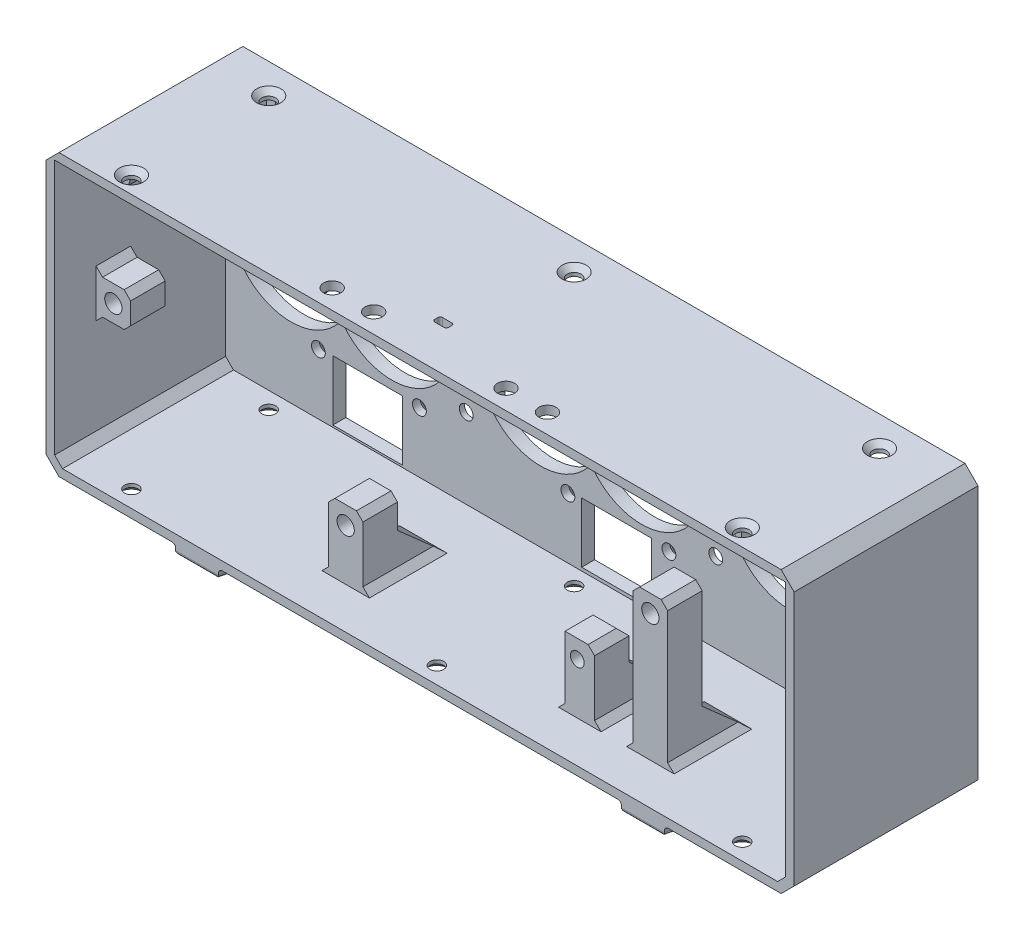
from build123d import *
from OCP.BRepFilletAPI import BRepFilletAPI_MakeChamfer

# Parameters (mm, degrees)
SKETCH1_W              = 173.3
SKETCH1_H              = 65
BOSS_EXTRUDE1_DEPTH    = 60
SHELL1_START           = -68.127794562
SHELL1_OUTLINE_W       = 61
SHELL1_OUTLINE_H       = 55
SHELL1_DEPTH           = 169.3
SKETCH3_W              = 219.37101133
SKETCH3_H              = 94.638771208
CUT_EXTRUDE3_DEPTH     = 17.4
BOSS_EXTRUDE2_DEPTH    = 30
SKETCH6_R              = 2
CUT_EXTRUDE5_DEPTH     = 9
SKETCH9_W              = 8
SKETCH9_H              = 8
BOSS_EXTRUDE3_DEPTH    = 16
SKETCH10_W             = 8
SKETCH10_H             = 8
BOSS_EXTRUDE4_DEPTH    = 33.5
SKETCH11_R             = 2
SKETCH11_R_2           = 1.6
CUT_EXTRUDE6_DEPTH     = 9
RIB5_REACH             = 138.256
SKETCH14_WALL_W        = 287.846240822
SKETCH14_WALL_H        = 8
RIB7_REACH             = 152.639
SKETCH16_WALL_W        = 316.612464196
SKETCH16_WALL_H        = 8
RIB12_REACH            = 138.256
SKETCH49_WALL_W        = 288.114138462
SKETCH49_WALL_H        = 8
SKETCH21_W             = 8
SKETCH21_H             = 8
BOSS_EXTRUDE5_DEPTH    = 8
SKETCH22_R             = 2
CUT_EXTRUDE10_DEPTH    = 9
SKETCH46_W             = 3
SKETCH46_H             = 6.581793069
CUT_EXTRUDE26_DEPTH    = 6.85
CUT_EXTRUDE7_START     = -18
CUT_EXTRUDE7_OUTLINE_W = 1.15
CUT_EXTRUDE7_OUTLINE_H = 16
CUT_EXTRUDE7_DEPTH     = 18
CHAMFER5_SIZE          = 2.8
CHAMFER5_SIZE2         = 1.616580754
SKETCH19_R             = 1.6
CUT_EXTRUDE8_DEPTH     = 3
SKETCH20_W             = 10.4
SKETCH20_H             = 32.4
CUT_EXTRUDE9_DEPTH     = 1.8
SKETCH24_R             = 1.6
CUT_EXTRUDE12_DEPTH    = 1.2
SKETCH25_R             = 2
CUT_EXTRUDE13_DEPTH    = 2
CUT_EXTRUDE14_DEPTH    = 2
SKETCH39_R             = 1.6
CUT_EXTRUDE21_DEPTH    = 2
CUT_EXTRUDE20_START    = -2
SKETCH38_R             = 1.6
CUT_EXTRUDE20_DEPTH    = 2
SKETCH40_W             = 16.181333655
SKETCH40_H             = 13.908508066
SKETCH40_W_2           = 16.181333654
SKETCH40_H_2           = 13.908508065
SKETCH40_W_3           = 24.137032917
SKETCH40_H_3           = 10.833560852
CUT_EXTRUDE22_DEPTH    = 3
SKETCH42_W             = 10
SKETCH42_H             = 40
BOSS_EXTRUDE6_DEPTH    = 10
CUT_EXTRUDE23_REACH    = 163.935
CHAMFER3_SIZE          = 3
CHAMFER1_SIZE          = 1.5
CHAMFER2_SIZE          = 1.2
FILLET2_R              = 0.8
CHAMFER4_SIZE          = 1.828427


# Read off the part's stored shape, not the designer's step: Shell1, Cut-Extrude7
with BuildPart() as part:
    # Sketch1 → Boss-Extrude1 (new body)
    with BuildSketch(Plane.XY):
        with Locations((16.522205438, 29.735649547)):
            Rectangle(SKETCH1_W, SKETCH1_H)
    extrude(amount=BOSS_EXTRUDE1_DEPTH)

    # Shell1 outline → Shell1 (cut)
    with BuildSketch(Plane.YZ.offset(SHELL1_START)):
        with Locations((29.735649547, 30.5)):
            Rectangle(SHELL1_OUTLINE_W, SHELL1_OUTLINE_H)
    extrude(amount=SHELL1_DEPTH, mode=Mode.SUBTRACT)

    # Sketch3 → Cut-Extrude3 (cut)
    with BuildSketch(Plane.XY.offset(60)):
        with Locations((3.172205438, 21.820567217)):
            Rectangle(SKETCH3_W, SKETCH3_H)
    extrude(amount=-CUT_EXTRUDE3_DEPTH, mode=Mode.SUBTRACT)

    # Sketch5 → Boss-Extrude2 (add)
    with BuildSketch(Plane.XY.offset(3)):
        with BuildLine():
            Line((-68.127794562, 60.235649547), (-60.127794562, 60.235649547))
            Line((-60.127794562, 60.235649547), (-60.127794562, 56.235649547))
            ThreePointArc((-60.127794562, 56.235649547), (-61.299367437, 53.407222422), (-64.127794562, 52.235649547))
            Line((-64.127794562, 52.235649547), (-68.127794562, 52.235649547))
            Line((-68.127794562, 52.235649547), (-68.127794562, 60.235649547))
        make_face()
        with BuildLine():
            Line((101.172205438, 60.235649547), (93.172205438, 60.235649547))
            Line((93.172205438, 60.235649547), (93.172205438, 56.235649547))
            ThreePointArc((93.172205438, 56.235649547), (94.343778313, 53.407222422), (97.172205438, 52.235649547))
            Line((97.172205438, 52.235649547), (101.172205438, 52.235649547))
            Line((101.172205438, 52.235649547), (101.172205438, 60.235649547))
        make_face()
        with BuildLine():
            Line((-31.227794562, 60.235649547), (-15.727794562, 60.235649547))
            Line((-15.727794562, 60.235649547), (-15.727794562, 56.235649547))
            ThreePointArc((-15.727794562, 56.235649547), (-16.899367437, 53.407222422), (-19.727794562, 52.235649547))
            Line((-19.727794562, 52.235649547), (-27.227794562, 52.235649547))
            ThreePointArc((-27.227794562, 52.235649547), (-30.056221687, 53.407222422), (-31.227794562, 56.235649547))
            Line((-31.227794562, 56.235649547), (-31.227794562, 60.235649547))
        make_face()
        with BuildLine():
            Line((56.272205438, 60.235649547), (64.272205438, 60.235649547))
            Line((64.272205438, 60.235649547), (64.272205438, 56.235649547))
            ThreePointArc((64.272205438, 56.235649547), (60.272205438, 52.235649547), (56.272205438, 56.235649547))
            Line((56.272205438, 56.235649547), (56.272205438, 60.235649547))
        make_face()
    extrude(amount=BOSS_EXTRUDE2_DEPTH)

    # Sketch6 → Cut-Extrude5 (cut)
    with BuildSketch(Plane.XY.offset(33)):
        with Locations((-64.127794562, 56.235649547)):
            Circle(SKETCH6_R)
        with Locations((-27.227794562, 56.235649547)):
            Circle(SKETCH6_R)
        with Locations((-19.727794562, 56.235649547)):
            Circle(SKETCH6_R)
        with Locations((60.272205438, 56.235649547)):
            Circle(SKETCH6_R)
        with Locations((97.172205438, 56.235649547)):
            Circle(SKETCH6_R)
    extrude(amount=-CUT_EXTRUDE5_DEPTH, mode=Mode.SUBTRACT)

    # Sketch9 → Boss-Extrude3 (add)
    with BuildSketch(Plane(origin=(0, -0.764350453, 0), x_dir=(1, 0, 0), z_dir=(0, 1, 0))):
        with Locations((43.352205438, -29)):
            Rectangle(SKETCH9_W, SKETCH9_H)
        with Locations((-10.307794562, -29)):
            Rectangle(SKETCH9_W, SKETCH9_H)
    extrude(amount=BOSS_EXTRUDE3_DEPTH)

    # Sketch10 → Boss-Extrude4 (add)
    with BuildSketch(Plane(origin=(0, -0.764350453, 0.764350453), x_dir=(1, 0, 0), z_dir=(0, -1, 0))):
        with Locations((60.272205438, 28.235649547)):
            Rectangle(SKETCH10_W, SKETCH10_H)
    extrude(amount=-BOSS_EXTRUDE4_DEPTH)

    # Sketch11 → Cut-Extrude6 (cut)
    with BuildSketch(Plane.XY.offset(33)):
        with Locations((-10.307794562, 11.055649547)):
            Circle(SKETCH11_R)
        with Locations((43.352205438, 11.055649547)):
            Circle(SKETCH11_R_2)
        with Locations((60.272205438, 28.685649547)):
            Circle(SKETCH11_R)
    extrude(amount=-CUT_EXTRUDE6_DEPTH, mode=Mode.SUBTRACT)

    # Sketch14 wall → Rib5 (add, up to next)
    with BuildSketch(Plane(origin=(-10.307794562, 3.645649547, 20), x_dir=(0, -0.661472797491, -0.749969158153), z_dir=(0, -0.749969158153, 0.661472797491)), mode=Mode.PRIVATE) as rib5_sk1:
        Rectangle(SKETCH14_WALL_W, SKETCH14_WALL_H)
    rib5_tool1 = extrude(rib5_sk1.sketch, amount=RIB5_REACH, mode=Mode.PRIVATE) - part.part
    add(rib5_tool1.solids().sort_by_distance((-10.307794562, 3.645649547, 20))[0])

    # Sketch16 wall → Rib7 (add, up to next)
    with BuildSketch(Plane(origin=(60.272205438, 3.645649547, 20), x_dir=(0, -0.661472797491, -0.749969158153), z_dir=(0, -0.749969158153, 0.661472797491)), mode=Mode.PRIVATE) as rib7_sk1:
        Rectangle(SKETCH16_WALL_W, SKETCH16_WALL_H)
    rib7_tool1 = extrude(rib7_sk1.sketch, amount=RIB7_REACH, mode=Mode.PRIVATE) - part.part
    add(rib7_tool1.solids().sort_by_distance((60.272205438, 3.645649547, 20))[0])

    # Sketch49 wall → Rib12 (add, up to next)
    with BuildSketch(Plane(origin=(43.352205438, 3.845649547, 20), x_dir=(0, -0.677852492662, -0.735197931303), z_dir=(0, -0.735197931303, 0.677852492662)), mode=Mode.PRIVATE) as rib12_sk1:
        Rectangle(SKETCH49_WALL_W, SKETCH49_WALL_H)
    rib12_tool1 = extrude(rib12_sk1.sketch, amount=RIB12_REACH, mode=Mode.PRIVATE) - part.part
    add(rib12_tool1.solids().sort_by_distance((43.352205438, 3.845649547, 20))[0])

    # Sketch21 → Boss-Extrude5 (add)
    with BuildSketch(Plane(origin=(-68.127794562, 0, 0), x_dir=(0, 0, -1), z_dir=(1, 0, 0))):
        with Locations((-29, 28.685649547)):
            Rectangle(SKETCH21_W, SKETCH21_H)
    extrude(amount=BOSS_EXTRUDE5_DEPTH)

    # Sketch22 → Cut-Extrude10 (cut)
    with BuildSketch(Plane.XY.offset(33)):
        with Locations((-64.127794562, 28.685649547)):
            Circle(SKETCH22_R)
    extrude(amount=-CUT_EXTRUDE10_DEPTH, mode=Mode.SUBTRACT)

    # Sketch46 → Cut-Extrude26 (cut)
    with BuildSketch(Plane.ZY.offset(-39.352205438)):
        with Locations((29, 11.055649547)):
            Rectangle(SKETCH46_W, SKETCH46_H)
    extrude(amount=-CUT_EXTRUDE26_DEPTH, mode=Mode.SUBTRACT)

    # Cut-Extrude7 outline → Cut-Extrude7 (cut)
    with BuildSketch(Plane.XY.offset(33).offset(CUT_EXTRUDE7_START)):
        with Locations((39.927205438, 7.235649547)):
            Rectangle(CUT_EXTRUDE7_OUTLINE_W, CUT_EXTRUDE7_OUTLINE_H)
    extrude(amount=CUT_EXTRUDE7_DEPTH, mode=Mode.SUBTRACT)

    # Chamfer5: one chamfer whose edges measure the first distance from different faces: ONE call of the kernel's chamfer builder (chamfer() names one face for all edges)
    chamfer5_edges_1 = [part.edges().sort_by_distance(p)[0] for p in [
        (46.202205438, 14.346546081, 29),
    ]]
    chamfer5_side_1 = [part.faces().sort_by_distance(p)[0] for p in [
        (43.352205438, 14.346546081, 29),
    ]]
    chamfer5_edges_2 = [part.edges().sort_by_distance(p)[0] for p in [
        (46.202205438, 7.764753012, 29),
    ]]
    chamfer5_side_2 = [part.faces().sort_by_distance(p)[0] for p in [
        (43.352205438, 7.764753012, 29),
    ]]
    chamfer5 = BRepFilletAPI_MakeChamfer(part.part.solid().wrapped)
    for e in chamfer5_edges_1:
        chamfer5.Add(CHAMFER5_SIZE, CHAMFER5_SIZE2, e.wrapped, chamfer5_side_1[0].wrapped)  # the first distance lies on this face
    for e in chamfer5_edges_2:
        chamfer5.Add(CHAMFER5_SIZE, CHAMFER5_SIZE2, e.wrapped, chamfer5_side_2[0].wrapped)  # the first distance lies on this face
    add(Compound.cast(chamfer5.Shape()), mode=Mode.REPLACE)

    # Sketch19 → Cut-Extrude8 (cut)
    with BuildSketch(Plane(origin=(0, 0, 0), x_dir=(-1, 0, 0), z_dir=(0, 0, -1))):
        with Locations((1.527794562, 46.235649547)):
            Circle(SKETCH19_R)
        with Locations((-11.172205438, 13.235649547)):
            Circle(SKETCH19_R)
        with Locations((-34.572205438, 13.235649547)):
            Circle(SKETCH19_R)
        with Locations((-21.872205438, 46.235649547)):
            Circle(SKETCH19_R)
        with Locations((23.227794562, 13.235649547)):
            Circle(SKETCH19_R)
        with Locations((46.627794562, 13.235649547)):
            Circle(SKETCH19_R)
        with Locations((35.927794562, 46.235649547)):
            Circle(SKETCH19_R)
        with Locations((59.327794562, 46.235649547)):
            Circle(SKETCH19_R)
        with Locations((-92.372205438, 13.235649547)):
            Circle(SKETCH19_R)
        with Locations((-79.672205438, 46.235649547)):
            Circle(SKETCH19_R)
        with Locations((-56.272205438, 46.235649547)):
            Circle(SKETCH19_R)
        with Locations((-68.972205438, 13.235649547)):
            Circle(SKETCH19_R)
        with BuildLine():
            Line((6.377794562, 38.464910684), (6.377794562, 21.00638841))
            ThreePointArc((6.377794562, 21.00638841), (-4.822205438, 15.535649547), (-16.022205438, 21.00638841))
            Line((-16.022205438, 21.00638841), (-16.022205438, 38.464910684))
            ThreePointArc((-16.022205438, 38.464910684), (-4.822205438, 43.935649547), (6.377794562, 38.464910684))
        make_face()
        with BuildLine():
            Line((-74.822205438, 21.00638841), (-74.822205438, 38.464910684))
            ThreePointArc((-74.822205438, 38.464910684), (-86.022205438, 43.935649547), (-97.222205438, 38.464910684))
            Line((-97.222205438, 38.464910684), (-97.222205438, 21.00638841))
            ThreePointArc((-97.222205438, 21.00638841), (-86.022205438, 15.535649547), (-74.822205438, 21.00638841))
        make_face()
        with BuildLine():
            Line((40.777794562, 38.464910684), (40.777794562, 21.00638841))
            ThreePointArc((40.777794562, 21.00638841), (29.577794562, 15.535649547), (18.377794562, 21.00638841))
            Line((18.377794562, 21.00638841), (18.377794562, 38.464910684))
            ThreePointArc((18.377794562, 38.464910684), (29.577794562, 43.935649547), (40.777794562, 38.464910684))
        make_face()
        with BuildLine():
            Line((64.177794562, 38.464910684), (64.177794562, 21.00638841))
            ThreePointArc((64.177794562, 21.00638841), (52.977794562, 15.535649547), (41.777794562, 21.00638841))
            Line((41.777794562, 21.00638841), (41.777794562, 38.464910684))
            ThreePointArc((41.777794562, 38.464910684), (52.977794562, 43.935649547), (64.177794562, 38.464910684))
        make_face()
        with BuildLine():
            Line((-51.422205438, 21.00638841), (-51.422205438, 38.464910684))
            ThreePointArc((-51.422205438, 38.464910684), (-62.622205438, 43.935649547), (-73.822205438, 38.464910684))
            Line((-73.822205438, 38.464910684), (-73.822205438, 21.00638841))
            ThreePointArc((-73.822205438, 21.00638841), (-62.622205438, 15.535649547), (-51.422205438, 21.00638841))
        make_face()
        with BuildLine():
            Line((-17.022205438, 21.00638841), (-17.022205438, 38.464910684))
            ThreePointArc((-17.022205438, 38.464910684), (-28.222205438, 43.935649547), (-39.422205438, 38.464910684))
            Line((-39.422205438, 38.464910684), (-39.422205438, 21.00638841))
            ThreePointArc((-39.422205438, 21.00638841), (-28.222205438, 15.535649547), (-17.022205438, 21.00638841))
        make_face()
    extrude(amount=-CUT_EXTRUDE8_DEPTH, mode=Mode.SUBTRACT)

    # Sketch20 → Cut-Extrude9 (cut)
    with BuildSketch(Plane(origin=(0, 0, 0), x_dir=(-1, 0, 0), z_dir=(0, 0, -1))):
        with Locations((12.377794562, 29.735649547)):
            Rectangle(SKETCH20_W, SKETCH20_H)
        with Locations((-45.422205438, 29.735649547)):
            Rectangle(SKETCH20_W, SKETCH20_H)
    extrude(amount=-CUT_EXTRUDE9_DEPTH, mode=Mode.SUBTRACT)

    # Sketch24 → Cut-Extrude12 (cut)
    with BuildSketch(Plane(origin=(0, 0, 1.8), x_dir=(-1, 0, 0), z_dir=(0, 0, -1))):
        with Locations((12.377794562, 41.735649547)):
            Circle(SKETCH24_R)
        with Locations((12.377794562, 17.735649547)):
            Circle(SKETCH24_R)
        with Locations(Location((-45.422205438, 41.735649547, 0), (0, 0, 180))):
            Circle(SKETCH24_R)
        with Locations(Location((-45.422205438, 17.735649547, 0), (0, 0, 180))):
            Circle(SKETCH24_R)
        with BuildLine():
            Line((8.877794562, 38.735649547), (15.877794562, 38.735649547))
            ThreePointArc((15.877794562, 38.735649547), (16.584901343, 38.442756328), (16.877794562, 37.735649547))
            Line((16.877794562, 37.735649547), (16.877794562, 21.735649547))
            ThreePointArc((16.877794562, 21.735649547), (16.584901343, 21.028542766), (15.877794562, 20.735649547))
            Line((15.877794562, 20.735649547), (8.877794562, 20.735649547))
            ThreePointArc((8.877794562, 20.735649547), (8.170687781, 21.028542766), (7.877794562, 21.735649547))
            Line((7.877794562, 21.735649547), (7.877794562, 37.735649547))
            ThreePointArc((7.877794562, 37.735649547), (8.170687781, 38.442756328), (8.877794562, 38.735649547))
        make_face()
        with BuildLine():
            Line((-41.922205438, 20.735649547), (-48.922205438, 20.735649547))
            ThreePointArc((-48.922205438, 20.735649547), (-49.629312219, 21.028542766), (-49.922205438, 21.735649547))
            Line((-49.922205438, 21.735649547), (-49.922205438, 37.735649547))
            ThreePointArc((-49.922205438, 37.735649547), (-49.629312219, 38.442756328), (-48.922205438, 38.735649547))
            Line((-48.922205438, 38.735649547), (-41.922205438, 38.735649547))
            ThreePointArc((-41.922205438, 38.735649547), (-41.215098657, 38.442756328), (-40.922205438, 37.735649547))
            Line((-40.922205438, 37.735649547), (-40.922205438, 21.735649547))
            ThreePointArc((-40.922205438, 21.735649547), (-41.215098657, 21.028542766), (-41.922205438, 20.735649547))
        make_face()
    extrude(amount=-CUT_EXTRUDE12_DEPTH, mode=Mode.SUBTRACT)

    # Sketch25 → Cut-Extrude13 (cut)
    with BuildSketch(Plane(origin=(0, 62.235649547, 0), x_dir=(1, 0, 0), z_dir=(0, 1, 0))):
        with Locations(Location((-8.337794562, -38.1, 0), (0, 0, 270))):
            Circle(SKETCH25_R)
        with Locations(Location((1.272205438, -38.1, 0), (0, 0, 270))):
            Circle(SKETCH25_R)
        with Locations(Location((31.922205438, -38.1, 0), (0, 0, 270))):
            Circle(SKETCH25_R)
        with Locations(Location((41.532205438, -38.1, 0), (0, 0, 270))):
            Circle(SKETCH25_R)
    extrude(amount=-CUT_EXTRUDE13_DEPTH, mode=Mode.SUBTRACT)

    # Sketch26 → Cut-Extrude14 (cut)
    with BuildSketch(Plane(origin=(0, 62.235649547, 0), x_dir=(1, 0, 0), z_dir=(0, 1, 0))):
        with BuildLine():
            Line((10.362205438, -31.26), (12.562205438, -31.26))
            ThreePointArc((12.562205438, -31.26), (12.915758829, -31.406446609), (13.062205438, -31.76))
            Line((13.062205438, -31.76), (13.062205438, -32.56))
            ThreePointArc((13.062205438, -32.56), (12.915758829, -32.913553391), (12.562205438, -33.06))
            Line((12.562205438, -33.06), (10.362205438, -33.06))
            ThreePointArc((10.362205438, -33.06), (10.008652047, -32.913553391), (9.862205438, -32.56))
            Line((9.862205438, -32.56), (9.862205438, -31.76))
            ThreePointArc((9.862205438, -31.76), (10.008652047, -31.406446609), (10.362205438, -31.26))
        make_face()
    extrude(amount=-CUT_EXTRUDE14_DEPTH, mode=Mode.SUBTRACT)

    # Sketch39 → Cut-Extrude21 (cut)
    with BuildSketch(Plane(origin=(0, 62.235649547, 0), x_dir=(1, 0, 0), z_dir=(0, 1, 0))):
        with Locations(Location((87.272205438, -38.7, 0), (0, 0, 270))):
            Circle(SKETCH39_R)
        with Locations(Location((-54.227794562, -38.7, 0), (0, 0, 90))):
            Circle(SKETCH39_R)
        with Locations(Location((87.272205438, -6.9, 0), (0, 0, 270))):
            Circle(SKETCH39_R)
        with Locations(Location((-54.227794562, -6.9, 0), (0, 0, 270))):
            Circle(SKETCH39_R)
        with Locations(Location((16.522205438, -6.9, 0), (0, 0, 270))):
            Circle(SKETCH39_R)
    extrude(amount=-CUT_EXTRUDE21_DEPTH, mode=Mode.SUBTRACT)

    # Sketch38 → Cut-Extrude20 (cut)
    with BuildSketch(Plane.XZ.offset(2.764350453).offset(CUT_EXTRUDE20_START)):
        with Locations(Location((16.522205438, 38.7, 0), (0, 0, 270))):
            Circle(SKETCH38_R)
        with Locations(Location((87.272205438, 38.7, 0), (0, 0, 90))):
            Circle(SKETCH38_R)
        with Locations(Location((-54.227794562, 38.7, 0), (0, 0, 270))):
            Circle(SKETCH38_R)
        with Locations(Location((87.272205438, 6.9, 0), (0, 0, 90))):
            Circle(SKETCH38_R)
        with Locations(Location((-54.227794562, 6.9, 0), (0, 0, 90))):
            Circle(SKETCH38_R)
        with Locations(Location((16.522205438, 6.9, 0), (0, 0, 90))):
            Circle(SKETCH38_R)
    extrude(amount=CUT_EXTRUDE20_DEPTH, mode=Mode.SUBTRACT)

    # Sketch40 → Cut-Extrude22 (cut)
    with BuildSketch(Plane(origin=(0, 0, 0), x_dir=(-1, 0, 0), z_dir=(0, 0, -1))):
        with Locations((-9.773770085, 53.126792965)):
            Rectangle(SKETCH40_W, SKETCH40_H)
        with Locations((-81.510926973, 7.384969703)):
            Rectangle(SKETCH40_W_2, SKETCH40_H)
        with Locations((-22.443220831, 6.95213244)):
            Rectangle(SKETCH40_W, SKETCH40_H)
        with Locations((35.187907808, 6.662789062)):
            Rectangle(SKETCH40_W, SKETCH40_H)
        with Locations((48.439772312, 53.236370834)):
            Rectangle(SKETCH40_W, SKETCH40_H)
        with Locations((-41.333295054, 53.509767805)):
            Rectangle(SKETCH40_W, SKETCH40_H_2)
        with Locations((-78.754829992, 54.756733084)):
            Rectangle(SKETCH40_W_3, SKETCH40_H_3)
    extrude(amount=-CUT_EXTRUDE22_DEPTH, mode=Mode.SUBTRACT)

    # Sketch42 → Boss-Extrude6 (add)
    with BuildSketch(Plane.XZ.offset(2.764350453)):
        with Locations((68.172205438, 22.6)):
            Rectangle(SKETCH42_W, SKETCH42_H)
        with Locations((-35.127794562, 22.6)):
            Rectangle(SKETCH42_W, SKETCH42_H)
    extrude(amount=BOSS_EXTRUDE6_DEPTH)

    # Cut-Extrude23: up to this face of the body (flat: up to its plane)
    cut_extrude23_end = Plane(part.part.faces().sort_by_distance((73.172205438, -7.764350453, 22.6))[0])
    # Sketch43 → Cut-Extrude23 (cut, up to the picked face)
    with BuildSketch(Plane.ZY.offset(40.127794562), mode=Mode.PRIVATE) as cut_extrude23_sk1:
        Polygon((2.6, -12.764350453), (42.6, -4.764350453), (42.6, -12.764350453), align=None)
    cut_extrude23_tool1 = split(extrude(cut_extrude23_sk1.sketch, amount=-CUT_EXTRUDE23_REACH, mode=Mode.PRIVATE), bisect_by=cut_extrude23_end, keep=Keep.BOTH, mode=Mode.PRIVATE)
    add(cut_extrude23_tool1.solids().sort_by(Axis((-40.127795, -10.097684, 29.266667), (1, 0, 0)))[0], mode=Mode.SUBTRACT)

    # Chamfer3
    chamfer3_edges = [part.edges().sort_by_distance(p)[0] for p in [
        (-70.127794562, 62.235649547, 21.3),
        (103.172205438, 62.235649547, 21.3),
        (103.172205438, -2.764350453, 21.3),
        (-70.127794562, -2.764350453, 21.3),
    ]]
    chamfer(chamfer3_edges, length=CHAMFER3_SIZE)

    # Chamfer1
    chamfer1_edges = [part.edges().sort_by_distance(p)[0] for p in [
        (40.502205438, -0.764350453, 24),
        (56.272205438, -0.764350453, 20),
        (64.272205438, -0.764350453, 20),
        (47.352205438, -0.764350453, 20),
        (-6.307794562, -0.764350453, 20),
        (-14.307794562, -0.764350453, 20),
        (-68.127794562, 24.685649547, 29),
        (-68.127794562, 32.685649547, 29),
        (93.172205438, 58.235649547, 3),
        (99.172205438, 52.235649547, 3),
        (94.343778313, 53.407222422, 3),
        (56.272205438, 58.235649547, 3),
        (64.272205438, 58.235649547, 3),
        (60.272205438, 52.235649547, 3),
        (-31.227794562, 58.235649547, 3),
        (-30.056221687, 53.407222422, 3),
        (-23.477794562, 52.235649547, 3),
        (-15.727794562, 58.235649547, 3),
        (-16.899367437, 53.407222422, 3),
        (-66.127794562, 52.235649547, 3),
        (-60.127794562, 58.235649547, 3),
        (-61.299367437, 53.407222422, 3),
        (56.272205438, 32.735649547, 29),
        (64.272205438, 32.735649547, 29),
        (43.927205438, 15.235649547, 25),
        (47.352205438, 15.235649547, 29),
        (-60.127794562, 24.685649547, 29),
        (-60.127794562, 32.685649547, 29),
        (-6.307794562, 15.235649547, 29),
        (-14.307794562, 15.235649547, 29),
    ]]
    chamfer(chamfer1_edges, length=CHAMFER1_SIZE)

    # Chamfer2
    # the kernel refuses this chamfer: 1.2 mm, written as the material it takes off along each edge
    with BuildSketch(Plane(origin=(-35.927794562, 46.235649547, 0), x_dir=(-1, 0, 0), z_dir=(0, -1, 0))) as chamfer2_piece_1:
        Polygon((1.6 + CHAMFER2_SIZE, 0), (1.6, -CHAMFER2_SIZE), (1.6, 0), align=None)
    revolve(axis=Axis((-35.927794562, 46.235649547, 0), (0, 0, -1)), mode=Mode.SUBTRACT)
    with BuildSketch(Plane(origin=(-46.627794562, 13.235649547, 0), x_dir=(-1, 0, 0), z_dir=(0, -1, 0))) as chamfer2_piece_2:
        Polygon((1.6 + CHAMFER2_SIZE, 0), (1.6, -CHAMFER2_SIZE), (1.6, 0), align=None)
    revolve(axis=Axis((-46.627794562, 13.235649547, 0), (0, 0, -1)), mode=Mode.SUBTRACT)
    with BuildSketch(Plane(origin=(-59.327794562, 46.235649547, 0), x_dir=(-1, 0, 0), z_dir=(0, -1, 0))) as chamfer2_piece_3:
        Polygon((1.6 + CHAMFER2_SIZE, 0), (1.6, -CHAMFER2_SIZE), (1.6, 0), align=None)
    revolve(axis=Axis((-59.327794562, 46.235649547, 0), (0, 0, -1)), mode=Mode.SUBTRACT)
    with BuildSketch(Plane(origin=(34.572205438, 13.235649547, 0), x_dir=(-1, 0, 0), z_dir=(0, -1, 0))) as chamfer2_piece_4:
        Polygon((1.6 + CHAMFER2_SIZE, 0), (1.6, -CHAMFER2_SIZE), (1.6, 0), align=None)
    revolve(axis=Axis((34.572205438, 13.235649547, 0), (0, 0, -1)), mode=Mode.SUBTRACT)
    with BuildSketch(Plane(origin=(-23.227794562, 13.235649547, 0), x_dir=(-1, 0, 0), z_dir=(0, -1, 0))) as chamfer2_piece_5:
        Polygon((1.6 + CHAMFER2_SIZE, 0), (1.6, -CHAMFER2_SIZE), (1.6, 0), align=None)
    revolve(axis=Axis((-23.227794562, 13.235649547, 0), (0, 0, -1)), mode=Mode.SUBTRACT)
    with BuildSketch(Plane(origin=(56.272205438, 46.235649547, 0), x_dir=(-1, 0, 0), z_dir=(0, -1, 0))) as chamfer2_piece_6:
        Polygon((1.6 + CHAMFER2_SIZE, 0), (1.6, -CHAMFER2_SIZE), (1.6, 0), align=None)
    revolve(axis=Axis((56.272205438, 46.235649547, 0), (0, 0, -1)), mode=Mode.SUBTRACT)
    with BuildSketch(Plane(origin=(68.972205438, 13.235649547, 0), x_dir=(-1, 0, 0), z_dir=(0, -1, 0))) as chamfer2_piece_7:
        Polygon((1.6 + CHAMFER2_SIZE, 0), (1.6, -CHAMFER2_SIZE), (1.6, 0), align=None)
    revolve(axis=Axis((68.972205438, 13.235649547, 0), (0, 0, -1)), mode=Mode.SUBTRACT)
    with BuildSketch(Plane(origin=(79.672205438, 46.235649547, 0), x_dir=(-1, 0, 0), z_dir=(0, -1, 0))) as chamfer2_piece_8:
        Polygon((1.6 + CHAMFER2_SIZE, 0), (1.6, -CHAMFER2_SIZE), (1.6, 0), align=None)
    revolve(axis=Axis((79.672205438, 46.235649547, 0), (0, 0, -1)), mode=Mode.SUBTRACT)
    with BuildSketch(Plane(origin=(21.872205438, 46.235649547, 0), x_dir=(-1, 0, 0), z_dir=(0, -1, 0))) as chamfer2_piece_9:
        Polygon((1.6 + CHAMFER2_SIZE, 0), (1.6, -CHAMFER2_SIZE), (1.6, 0), align=None)
    revolve(axis=Axis((21.872205438, 46.235649547, 0), (0, 0, -1)), mode=Mode.SUBTRACT)
    with BuildSketch(Plane(origin=(11.172205438, 13.235649547, 0), x_dir=(-1, 0, 0), z_dir=(0, -1, 0))) as chamfer2_piece_10:
        Polygon((1.6 + CHAMFER2_SIZE, 0), (1.6, -CHAMFER2_SIZE), (1.6, 0), align=None)
    revolve(axis=Axis((11.172205438, 13.235649547, 0), (0, 0, -1)), mode=Mode.SUBTRACT)
    with BuildSketch(Plane(origin=(-1.527794562, 46.235649547, 0), x_dir=(-1, 0, 0), z_dir=(0, -1, 0))) as chamfer2_piece_11:
        Polygon((1.6 + CHAMFER2_SIZE, 0), (1.6, -CHAMFER2_SIZE), (1.6, 0), align=None)
    revolve(axis=Axis((-1.527794562, 46.235649547, 0), (0, 0, -1)), mode=Mode.SUBTRACT)
    with BuildSketch(Plane(origin=(92.372205438, 13.235649547, 0), x_dir=(-1, 0, 0), z_dir=(0, -1, 0))) as chamfer2_piece_12:
        Polygon((1.6 + CHAMFER2_SIZE, 0), (1.6, -CHAMFER2_SIZE), (1.6, 0), align=None)
    revolve(axis=Axis((92.372205438, 13.235649547, 0), (0, 0, -1)), mode=Mode.SUBTRACT)
    with BuildSketch(Plane(origin=(-54.227794562, 62.235649547, 38.7), x_dir=(0, 0, -1), z_dir=(1, 0, 0))) as chamfer2_piece_13:
        Polygon((1.6 + CHAMFER2_SIZE, 0), (1.6, -CHAMFER2_SIZE), (1.6, 0), align=None)
    revolve(axis=Axis((-54.227794562, 62.235649547, 38.7), (0, 1, 0)), mode=Mode.SUBTRACT)
    with BuildSketch(Plane(origin=(87.272205438, 62.235649547, 6.9), x_dir=(0, 0, 1), z_dir=(-1, 0, 0))) as chamfer2_piece_14:
        Polygon((1.6 + CHAMFER2_SIZE, 0), (1.6, -CHAMFER2_SIZE), (1.6, 0), align=None)
    revolve(axis=Axis((87.272205438, 62.235649547, 6.9), (0, 1, 0)), mode=Mode.SUBTRACT)
    with BuildSketch(Plane(origin=(-54.227794562, 62.235649547, 6.9), x_dir=(0, 0, 1), z_dir=(-1, 0, 0))) as chamfer2_piece_15:
        Polygon((1.6 + CHAMFER2_SIZE, 0), (1.6, -CHAMFER2_SIZE), (1.6, 0), align=None)
    revolve(axis=Axis((-54.227794562, 62.235649547, 6.9), (0, 1, 0)), mode=Mode.SUBTRACT)
    with BuildSketch(Plane(origin=(16.522205438, 62.235649547, 6.9), x_dir=(0, 0, 1), z_dir=(-1, 0, 0))) as chamfer2_piece_16:
        Polygon((1.6 + CHAMFER2_SIZE, 0), (1.6, -CHAMFER2_SIZE), (1.6, 0), align=None)
    revolve(axis=Axis((16.522205438, 62.235649547, 6.9), (0, 1, 0)), mode=Mode.SUBTRACT)
    with BuildSketch(Plane(origin=(87.272205438, 62.235649547, 38.7), x_dir=(0, 0, 1), z_dir=(-1, 0, 0))) as chamfer2_piece_17:
        Polygon((1.6 + CHAMFER2_SIZE, 0), (1.6, -CHAMFER2_SIZE), (1.6, 0), align=None)
    revolve(axis=Axis((87.272205438, 62.235649547, 38.7), (0, 1, 0)), mode=Mode.SUBTRACT)
    with BuildSketch(Plane(origin=(87.272205438, -2.764350453, 6.9), x_dir=(0, 0, 1), z_dir=(1, 0, 0))) as chamfer2_piece_18:
        Polygon((1.6 + CHAMFER2_SIZE, 0), (1.6, -CHAMFER2_SIZE), (1.6, 0), align=None)
    revolve(axis=Axis((87.272205438, -2.764350453, 6.9), (0, -1, 0)), mode=Mode.SUBTRACT)
    with BuildSketch(Plane(origin=(87.272205438, -2.764350453, 38.7), x_dir=(0, 0, 1), z_dir=(1, 0, 0))) as chamfer2_piece_19:
        Polygon((1.6 + CHAMFER2_SIZE, 0), (1.6, -CHAMFER2_SIZE), (1.6, 0), align=None)
    revolve(axis=Axis((87.272205438, -2.764350453, 38.7), (0, -1, 0)), mode=Mode.SUBTRACT)
    with BuildSketch(Plane(origin=(-54.227794562, -2.764350453, 38.7), x_dir=(0, 0, -1), z_dir=(-1, 0, 0))) as chamfer2_piece_20:
        Polygon((1.6 + CHAMFER2_SIZE, 0), (1.6, -CHAMFER2_SIZE), (1.6, 0), align=None)
    revolve(axis=Axis((-54.227794562, -2.764350453, 38.7), (0, -1, 0)), mode=Mode.SUBTRACT)
    with BuildSketch(Plane(origin=(-54.227794562, -2.764350453, 6.9), x_dir=(0, 0, 1), z_dir=(1, 0, 0))) as chamfer2_piece_21:
        Polygon((1.6, -CHAMFER2_SIZE), (1.6 + CHAMFER2_SIZE, 0), (1.6, 0), align=None)
    revolve(axis=Axis((-54.227794562, -2.764350453, 6.9), (0, -1, 0)), mode=Mode.SUBTRACT)
    with BuildSketch(Plane(origin=(16.522205438, -2.764350453, 6.9), x_dir=(0, 0, 1), z_dir=(1, 0, 0))) as chamfer2_piece_22:
        Polygon((1.6 + CHAMFER2_SIZE, 0), (1.6, -CHAMFER2_SIZE), (1.6, 0), align=None)
    revolve(axis=Axis((16.522205438, -2.764350453, 6.9), (0, -1, 0)), mode=Mode.SUBTRACT)
    with BuildSketch(Plane(origin=(16.522205438, -2.764350453, 38.7), x_dir=(0, 0, -1), z_dir=(-1, 0, 0))) as chamfer2_piece_23:
        Polygon((1.6 + CHAMFER2_SIZE, 0), (1.6, -CHAMFER2_SIZE), (1.6, 0), align=None)
    revolve(axis=Axis((16.522205438, -2.764350453, 38.7), (0, -1, 0)), mode=Mode.SUBTRACT)

    # Fillet2
    fillet2_edges = [part.edges().sort_by_distance(p)[0] for p in [
        (63.172205438, -2.764350453, 22.6),
        (68.172205438, -2.764350453, 2.6),
        (63.172205438, -7.764350453, 2.6),
        (73.172205438, -2.764350453, 22.6),
        (73.172205438, -7.764350453, 2.6),
        (68.172205438, -12.764350453, 2.6),
        (-30.127794562, -2.764350453, 22.6),
        (-30.127794562, -7.764350453, 2.6),
        (-40.127794562, -2.764350453, 22.6),
        (-35.127794562, -2.764350453, 2.6),
        (-40.127794562, -7.764350453, 2.6),
        (-35.127794562, -12.764350453, 2.6),
        (63.172205438, -8.764350453, 22.6),
        (-30.127794562, -8.764350453, 22.6),
        (68.172205438, -4.764350453, 42.6),
        (-35.127794562, -4.764350453, 42.6),
        (-40.127794562, -8.764350453, 22.6),
        (73.172205438, -8.764350453, 22.6),
    ]]
    fillet(fillet2_edges, radius=FILLET2_R)

    # Chamfer4
    chamfer4_edges = [part.edges().sort_by_distance(p)[0] for p in [
        (101.172205438, -0.764350453, 22.8),
        (-68.127794562, -0.764350453, 22.8),
    ]]
    chamfer(chamfer4_edges, length=CHAMFER4_SIZE)


solid = part.part
